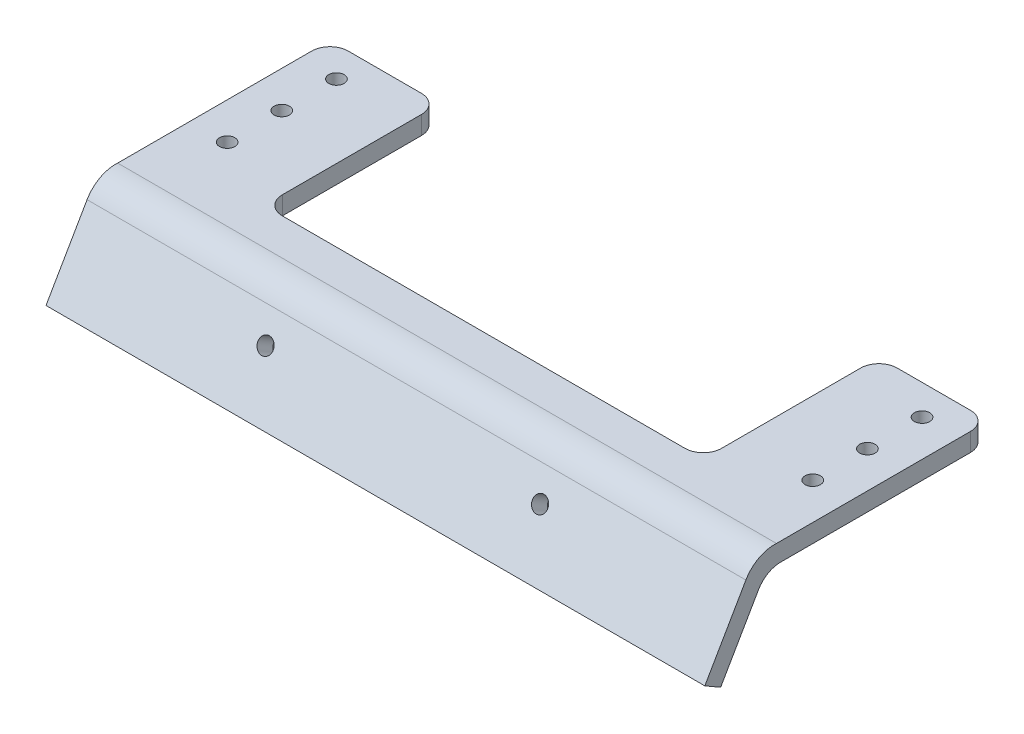
from build123d import *

# Parameters (mm, degrees)
SKETCH_1_W          = 180
SKETCH_1_H          = 63
EXTRUDE_1_DEPTH     = 5
SKETCH_2_R          = 2.1
CUT_EXTRUDE_1_DEPTH = 5
CUT_EXTRUDE_2_DEPTH = 200
SKETCH_5_W          = 180
SKETCH_5_H          = 30.5
EXTRUDE_2_DEPTH     = 5
SKETCH_7_R          = 2.1
CUT_EXTRUDE_3_DEPTH = 5
FILLET_3_R          = 9
FILLET_4_R          = 7
SKETCH_8_W          = 120
SKETCH_8_H          = 50
CUT_EXTRUDE_4_DEPTH = 5
FILLET_5_R          = 5


with BuildPart() as part:
    # 草图1 → 凸台-拉伸1 (new body)
    with BuildSketch(Plane(origin=(0, 0, 0), x_dir=(1, 0, 0), z_dir=(0, 1, 0))):
        Rectangle(SKETCH_1_W, SKETCH_1_H)
    extrude(amount=EXTRUDE_1_DEPTH)

    # 草图2 → 切除-拉伸1 (cut)
    with BuildSketch(Plane(origin=(0, 5, 0), x_dir=(1, 0, 0), z_dir=(0, 1, 0))):
        with Locations(Location((80, 23.27, 0), (0, 0, 270))):
            Circle(SKETCH_2_R)
        with Locations(Location((80, 8.34, 0), (0, 0, 270))):
            Circle(SKETCH_2_R)
        with Locations(Location((80, -6.59, 0), (0, 0, 270))):
            Circle(SKETCH_2_R)
        with Locations(Location((-80, 23.27, 0), (0, 0, 90))):
            Circle(SKETCH_2_R)
        with Locations(Location((-80, 8.34, 0), (0, 0, 90))):
            Circle(SKETCH_2_R)
        with Locations(Location((-80, -6.59, 0), (0, 0, 90))):
            Circle(SKETCH_2_R)
    extrude(amount=-CUT_EXTRUDE_1_DEPTH, mode=Mode.SUBTRACT)

    # 草图3 → 切除-拉伸2 (cut)
    with BuildSketch(Plane.ZY.offset(90)):
        Polygon((26.5, 5), (29.386751346, 0), (31.5, 0), (31.5, 5), align=None)
    extrude(amount=-CUT_EXTRUDE_2_DEPTH, mode=Mode.SUBTRACT)

    # 草图5 → 凸台-拉伸2 (add)
    with BuildSketch(Plane(origin=(0, 12.7248366, 22.040063509), x_dir=(1, 0, 0), z_dir=(0, 0.49999999999999806, 0.8660254037844399))):
        with Locations((0, -24.169872981)):
            Rectangle(SKETCH_5_W, SKETCH_5_H)
    extrude(amount=EXTRUDE_2_DEPTH)

    # 草图7 → 切除-拉伸3 (cut)
    with BuildSketch(Plane(origin=(0, 15.2248366, 26.370190528), x_dir=(1, 0, 0), z_dir=(0, 0.4999999999999981, 0.8660254037844397))):
        with Locations(Location((37.5, -24.419872981, 0), (0, 0, 270))):
            Circle(SKETCH_7_R)
        with Locations(Location((-37.5, -24.419872981, 0), (0, 0, 90))):
            Circle(SKETCH_7_R)
    extrude(amount=-CUT_EXTRUDE_3_DEPTH, mode=Mode.SUBTRACT)

    # 圆角3
    # the kernel refuses this fillet: 9 mm, written as the material it takes off along each edge
    with BuildSketch(Plane(origin=(110.155644371, 7.5, 30.830127019), x_dir=(0, -0.8660254037844398, 0.499999999999998), z_dir=(-1, 0, 0))) as fillet_3_piece_1:
        with BuildLine():
            CenterArc((8.062257748, -9), FILLET_3_R, 90, 63.612200039)
            Line((0, -5), (-0.161245155, -4.92))
            ThreePointArc((-0.161245155, -4.92), (-0.18, -2.5), (-0.18, 0))
            Line((-0.18, 0), (0, 0.18))
            Line((0, 0.18), (8.062257748, 0.18))
            Line((8.062257748, 0.18), (8.062257748, 0))
        make_face()
    extrude(amount=220.311288741, mode=Mode.SUBTRACT)

    # 圆角4
    fillet_4_edges = [part.edges().sort_by_distance(p)[0] for p in [
        (0, 0, 29.386751346),
    ]]
    fillet(fillet_4_edges, radius=FILLET_4_R)

    # 草图8 → 切除-拉伸4 (cut)
    with BuildSketch(Plane(origin=(0, 5, 0), x_dir=(1, 0, 0), z_dir=(0, 1, 0))):
        with Locations((0, 8.5)):
            Rectangle(SKETCH_8_W, SKETCH_8_H)
    extrude(amount=-CUT_EXTRUDE_4_DEPTH, mode=Mode.SUBTRACT)

    # 圆角5
    fillet_5_edges = [part.edges().sort_by_distance(p)[0] for p in [
        (60, 2.5, -31.5),
        (-60, 2.5, -31.5),
        (-60, 2.5, 16.5),
        (60, 2.5, 16.5),
        (-90, 2.5, -31.5),
        (90, 2.5, -31.5),
    ]]
    fillet(fillet_5_edges, radius=FILLET_5_R)


solid = part.part
